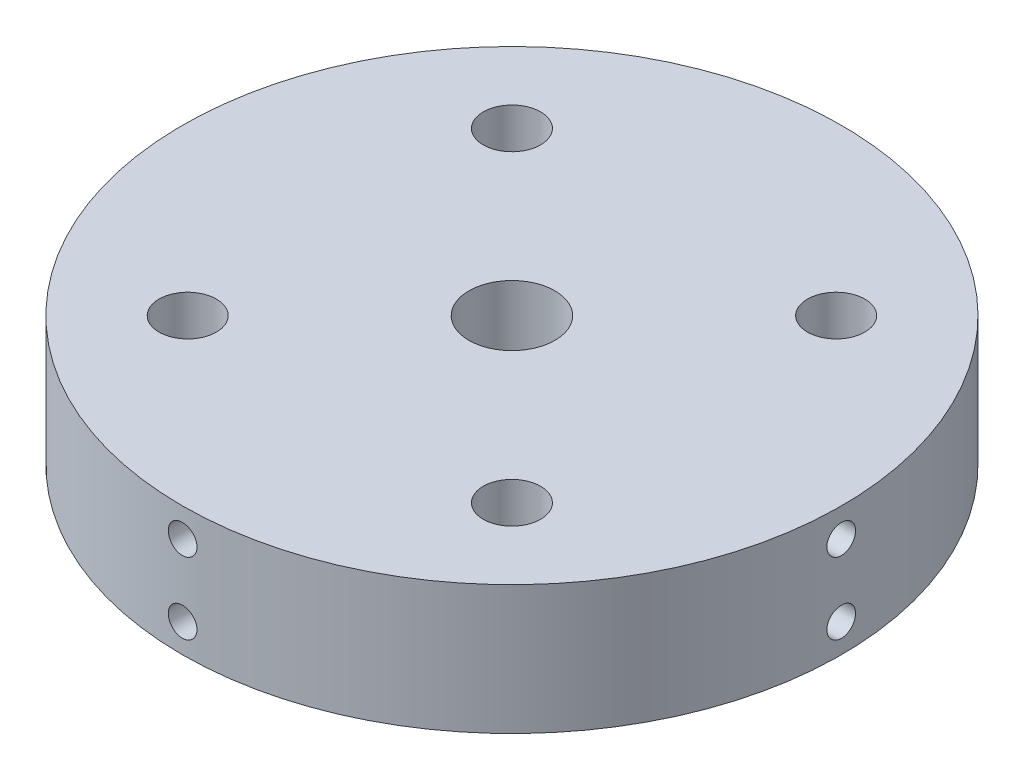
from build123d import *

# Parameters (mm, degrees)
SKETCH1_R           = 73.025
BOSS_EXTRUDE1_DEPTH = 28.575
SKETCH2_R           = 9.525
CUT_EXTRUDE1_DEPTH  = 108.153310145
SKETCH30_R          = 3.175
CUT_EXTRUDE2_DEPTH  = 25.4
CIRPATTERN3_COUNT   = 4
SKETCH31_R          = 6.35
CUT_EXTRUDE3_DEPTH  = 108.153310308
CIRPATTERN4_COUNT   = 4


with BuildPart() as part:
    # Sketch1 → Boss-Extrude1 (new body)
    with BuildSketch(Plane(origin=(0, 0, 0), x_dir=(1, 0, 0), z_dir=(0, 1, 0))):
        Circle(SKETCH1_R)
    extrude(amount=BOSS_EXTRUDE1_DEPTH)

    # Sketch2 → Cut-Extrude1 (cut, through all)
    with BuildSketch(Plane(origin=(0, 28.575, 0), x_dir=(1, 0, 0), z_dir=(0, 1, 0))):
        Circle(SKETCH2_R)
    extrude(amount=-CUT_EXTRUDE1_DEPTH, mode=Mode.SUBTRACT)

    # Sketch30 → Cut-Extrude2 (cut)
    with BuildSketch(Plane.XY.offset(73.025)):
        with Locations((0, 22.225)):
            Circle(SKETCH30_R)
        with Locations((0, 6.35)):
            Circle(SKETCH30_R)
    cut_extrude2 = extrude(amount=-CUT_EXTRUDE2_DEPTH, mode=Mode.SUBTRACT)

    # CirPattern3: Cut-Extrude2 ×4 about axis
    cirpattern3_axis = Axis((0, 28.575, 0), (0, -1, 0))
    for i in range(1, CIRPATTERN3_COUNT):
        add(cut_extrude2.rotate(cirpattern3_axis, i * 360 / CIRPATTERN3_COUNT), mode=Mode.SUBTRACT)

    # Sketch31 → Cut-Extrude3 (cut, through all)
    with BuildSketch(Plane(origin=(0, 28.575, 0), x_dir=(1, 0, 0), z_dir=(0, 1, 0))):
        with Locations((35.921024484, 35.921024484)):
            Circle(SKETCH31_R)
    cut_extrude3 = extrude(amount=-CUT_EXTRUDE3_DEPTH, mode=Mode.SUBTRACT)

    # CirPattern4: Cut-Extrude3 ×4 about axis
    cirpattern4_axis = Axis((0, 28.575, 0), (0, -1, 0))
    for i in range(1, CIRPATTERN4_COUNT):
        add(cut_extrude3.rotate(cirpattern4_axis, i * 360 / CIRPATTERN4_COUNT), mode=Mode.SUBTRACT)


solid = part.part
